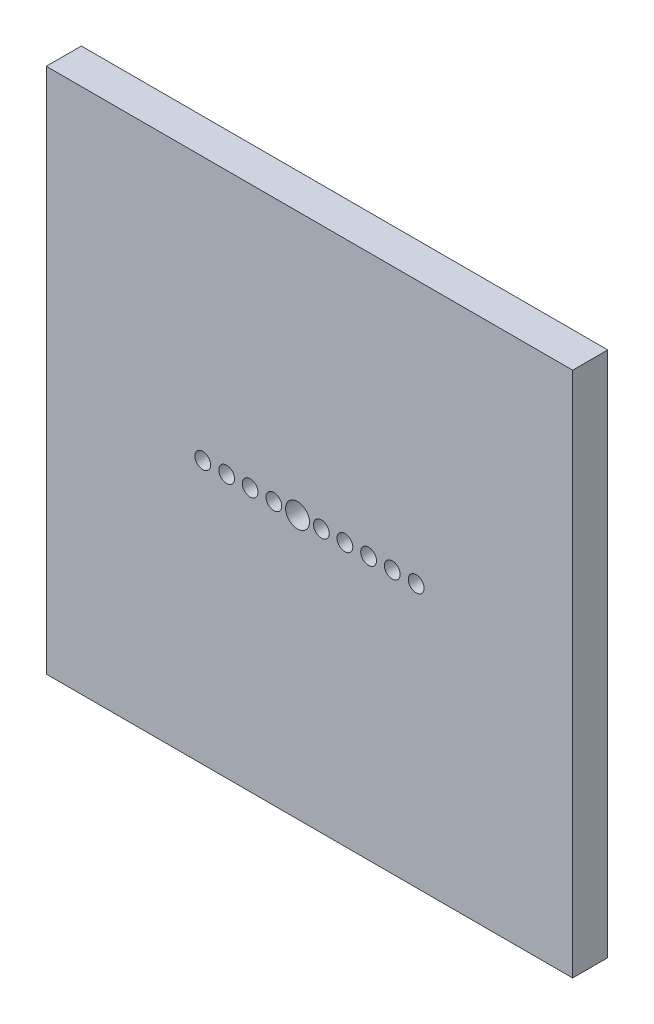
from build123d import *

# Parameters (mm, degrees)
ESQUISSE2_W             = 30
ESQUISSE2_H             = 30
BOSS_EXTRU_1_DEPTH      = 2
ESQUISSE3_R             = 0.45
ESQUISSE3_R_2           = 0.68
ENL_V_MAT_EXTRU_1_DEPTH = 10


with BuildPart() as part:
    # Esquisse2 → Boss.-Extru.1 (new body)
    with BuildSketch(Plane.XY):
        Rectangle(ESQUISSE2_W, ESQUISSE2_H)
    extrude(amount=BOSS_EXTRU_1_DEPTH)

    # Esquisse3 → Enlèv. mat.-Extru.1 (cut)
    with BuildSketch(Plane.XY.offset(2)):
        with Locations((-6.08, 0)):
            Circle(ESQUISSE3_R)
        with Locations((-4.72, 0)):
            Circle(ESQUISSE3_R)
        with Locations((-3.38, 0)):
            Circle(ESQUISSE3_R)
        with Locations((-2.03, 0)):
            Circle(ESQUISSE3_R)
        with Locations((-0.68, 0)):
            Circle(ESQUISSE3_R_2)
        with Locations((0.68, 0)):
            Circle(ESQUISSE3_R)
        with Locations((2.02, 0)):
            Circle(ESQUISSE3_R)
        with Locations((3.37, 0)):
            Circle(ESQUISSE3_R)
        with Locations((4.72, 0)):
            Circle(ESQUISSE3_R)
        with Locations((6.08, 0)):
            Circle(ESQUISSE3_R)
    extrude(amount=-ENL_V_MAT_EXTRU_1_DEPTH, mode=Mode.SUBTRACT)


solid = part.part
